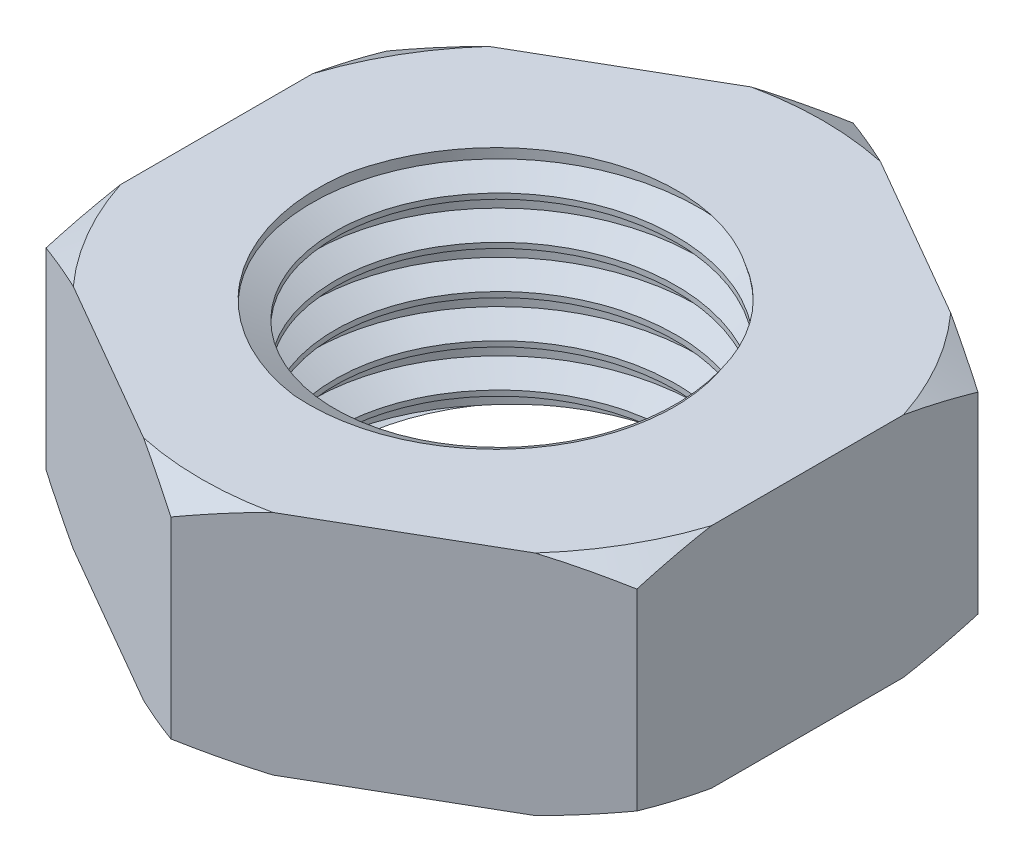
from build123d import *

# Parameters (mm, degrees)
SKETCH1_R           = 6
BOSS_EXTRUDE1_DEPTH = 4
THREAD1_PITCH       = 1.5


with BuildPart() as part:
    # Sketch1 → Boss-Extrude1 (new, symmetric)
    with BuildSketch(Plane(origin=(0, 0, 0), x_dir=(1, 0, 0), z_dir=(0, 1, 0))):
        Polygon((10.392304845, 6), (0, 12), (-10.392304845, 6), (-10.392304845, -6), (0, -12), (10.392304845, -6), align=None)
        with Locations(Location((0, 0, 0), (0, 0, 270))):
            Circle(SKETCH1_R, mode=Mode.SUBTRACT)
    extrude(amount=BOSS_EXTRUDE1_DEPTH, both=True)

    # Thread1: the profile of Thread Profile1 profile screwed along a right-hand helix of 18 turns, 8 arcs to a turn; built about Z, then put on its axis
    thread1_z = Axis((0, 0, 0), (0, 0, 1))
    thread1_corners = [(5.9997, 0, -0.000173205), (5.9997, 0, 1.312673201), (6.811898813, 0, 0.843749998), (6.811898813, 0, 0.468749998)]
    with BuildLine(mode=Mode.PRIVATE) as thread1_profile:
        Line(thread1_corners[0], thread1_corners[1])
        Line(thread1_corners[1], thread1_corners[2])
        Line(thread1_corners[2], thread1_corners[3])
        Line(thread1_corners[3], thread1_corners[0])
    thread1_cap = Face(thread1_profile.wire())
    thread1_turn_angles = [0, 22.5, 45, 67.5, 90, 112.5, 135, 157.5, 180, 202.5, 225, 247.5, 270, 292.5, 315, 337.5, 360]
    thread1_turn_weights = [1, 0.9238795325112867, 1, 0.9238795325112867, 1, 0.9238795325112867, 1, 0.9238795325112867, 1, 0.9238795325112867, 1, 0.9238795325112867, 1, 0.9238795325112867, 1, 0.9238795325112867, 1]
    thread1_turn_rails = [Edge.make_bspline([Vector(p[0], p[1], 0).rotate(thread1_z, thread1_turn_angles[k]) / thread1_turn_weights[k] + Vector(0, 0, p[2] + THREAD1_PITCH * thread1_turn_angles[k] / 360) for k in range(17)], [0, 0, 0, 1, 1, 2, 2, 3, 3, 4, 4, 5, 5, 6, 6, 7, 7, 8, 8, 8], 2, thread1_turn_weights) for p in thread1_corners]
    thread1_turn_sides = [Face.make_surface_from_curves(thread1_turn_rails[p[0]], thread1_turn_rails[p[1]]) for p in [(0, 1), (1, 2), (2, 3), (3, 0)]]
    thread1 = Plane(origin=(0, 6, 0), x_dir=(-1, 0, 0), z_dir=(0, -1, 0)) * Solid(Shell([*[p.moved(Location((0, 0, THREAD1_PITCH * i))) for i in range(18) for p in thread1_turn_sides], thread1_cap, thread1_cap.rotate(thread1_z, 6480).moved(Location((0, 0, THREAD1_PITCH * 6480 / 360)))]))
    add(thread1, mode=Mode.SUBTRACT)

    # Sketch5 → Cut-Revolve4 (revolve, cut)
    with BuildSketch(Plane(origin=(0, 0, 0), x_dir=(0, 0, -1), z_dir=(1, 0, 0))):
        Polygon((12, 3.380820618), (12, 4), (10.927549851, 4), align=None)
    cut_revolve4 = revolve(axis=Axis((0, 0, 0), (0, 1, 0)), mode=Mode.SUBTRACT)

    # Mirror1: Cut-Revolve4 across plane
    add(cut_revolve4.mirror(Plane.ZX), mode=Mode.SUBTRACT)


solid = part.part
